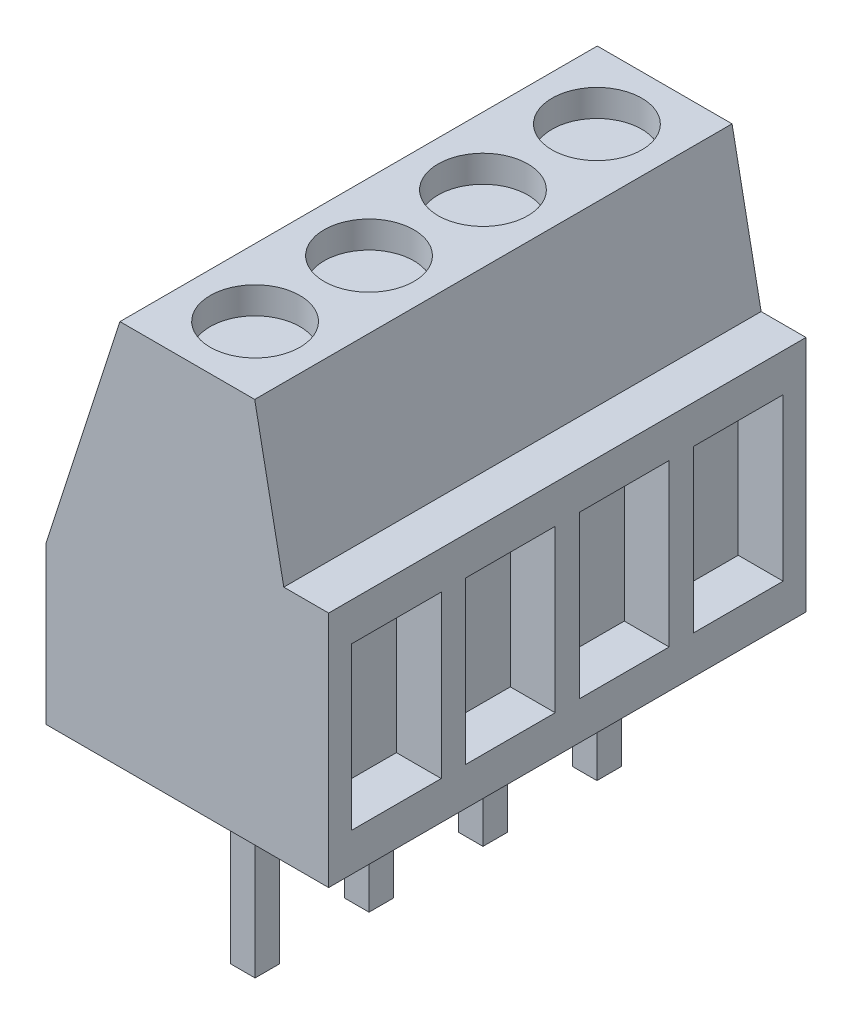
from build123d import *

# Parameters (mm, degrees)
BOSS_EXTRUDE1_DEPTH   = 10.64
SKETCH3_R             = 1
CUT_EXTRUDE1_DEPTH    = 0.6
SKETCH4_W             = 2
SKETCH4_H             = 3.6
CUT_EXTRUDE2_DEPTH    = 1
SKETCH5_W             = 0.55
SKETCH5_H             = 0.55
BOSS_EXTRUDE2_DEPTH   = 3.8
LPATTERN1_START       = 2.875
LPATTERN1_OUTLINE_W   = 3.8
LPATTERN1_OUTLINE_H   = 0.55
LPATTERN1_DEPTH       = 0.55
LPATTERN1_2_OUTLINE_W = 3.8
LPATTERN1_2_OUTLINE_H = 0.55
LPATTERN1_2_DEPTH     = 0.55
LPATTERN1_3_OUTLINE_W = 3.8
LPATTERN1_3_OUTLINE_H = 0.55
LPATTERN1_3_DEPTH     = 0.55
LPATTERN1_START_2     = 0.85
LPATTERN1_4_OUTLINE_W = 1
LPATTERN1_4_OUTLINE_H = 2
LPATTERN1_4_DEPTH     = 3.6
LPATTERN1_START_3     = 8
LPATTERN1_5_OUTLINE_R = 1
LPATTERN1_5_DEPTH     = 0.6


# Read off the part's stored shape, not the designer's step: LPattern1
with BuildPart() as part:
    # Sketch2 → Boss-Extrude1 (new body)
    with BuildSketch(Plane.XY):
        Polygon((6.3, 5.3), (5.3, 5.3), (4.652088092, 8.6), (1.647911908, 8.6), (0, 3.5), (0, 0), (6.3, 0), align=None)
    extrude(amount=-BOSS_EXTRUDE1_DEPTH)

    # Sketch3 → Cut-Extrude1 (cut)
    with BuildSketch(Plane(origin=(0, 8.6, 0), x_dir=(1, 0, 0), z_dir=(0, 1, 0))):
        with Locations(Location((3.15, 1.51, 0), (0, 0, 270))):
            Circle(SKETCH3_R)
    extrude(amount=-CUT_EXTRUDE1_DEPTH, mode=Mode.SUBTRACT)

    # Sketch4 → Cut-Extrude2 (cut)
    with BuildSketch(Plane(origin=(6.3, 0, 0), x_dir=(0, 0, -1), z_dir=(1, 0, 0))):
        with Locations((1.51, 2.65)):
            Rectangle(SKETCH4_W, SKETCH4_H)
    extrude(amount=-CUT_EXTRUDE2_DEPTH, mode=Mode.SUBTRACT)

    # LPattern1 4 outline → LPattern1 4 (cut)
    with BuildSketch(Plane(origin=(0, 0, 0), x_dir=(1, 0, 0), z_dir=(0, 1, 0)).offset(LPATTERN1_START_2)):
        with Locations((5.8, 9.13)):
            Rectangle(LPATTERN1_4_OUTLINE_W, LPATTERN1_4_OUTLINE_H)
        with Locations((5.8, 4.05)):
            Rectangle(LPATTERN1_4_OUTLINE_W, LPATTERN1_4_OUTLINE_H)
        with Locations((5.8, 6.59)):
            Rectangle(LPATTERN1_4_OUTLINE_W, LPATTERN1_4_OUTLINE_H)
    extrude(amount=LPATTERN1_4_DEPTH, mode=Mode.SUBTRACT)

    # LPattern1 5 outline → LPattern1 5 (cut)
    with BuildSketch(Plane(origin=(0, 0, 0), x_dir=(1, 0, 0), z_dir=(0, 1, 0)).offset(LPATTERN1_START_3)):
        with Locations((3.15, 9.13)):
            Circle(LPATTERN1_5_OUTLINE_R)
        with Locations((3.15, 6.59)):
            Circle(LPATTERN1_5_OUTLINE_R)
        with Locations((3.15, 4.05)):
            Circle(LPATTERN1_5_OUTLINE_R)
    extrude(amount=LPATTERN1_5_DEPTH, mode=Mode.SUBTRACT)


with BuildPart() as body_2:
    # Sketch5 → Boss-Extrude2 (new body)
    with BuildSketch(Plane.XZ):
        with Locations((3.15, -1.51)):
            Rectangle(SKETCH5_W, SKETCH5_H)
    extrude(amount=BOSS_EXTRUDE2_DEPTH)


with BuildPart() as body_3:
    # LPattern1 outline → LPattern1 (new body)
    with BuildSketch(Plane.YZ.offset(LPATTERN1_START)):
        with Locations((-1.9, -9.13)):
            Rectangle(LPATTERN1_OUTLINE_W, LPATTERN1_OUTLINE_H)
    extrude(amount=LPATTERN1_DEPTH)


with BuildPart() as body_4:
    # LPattern1 2 outline → LPattern1 2 (new body)
    with BuildSketch(Plane.YZ.offset(LPATTERN1_START)):
        with Locations((-1.9, -6.59)):
            Rectangle(LPATTERN1_2_OUTLINE_W, LPATTERN1_2_OUTLINE_H)
    extrude(amount=LPATTERN1_2_DEPTH)


with BuildPart() as body_5:
    # LPattern1 3 outline → LPattern1 3 (new body)
    with BuildSketch(Plane.YZ.offset(LPATTERN1_START)):
        with Locations((-1.9, -4.05)):
            Rectangle(LPATTERN1_3_OUTLINE_W, LPATTERN1_3_OUTLINE_H)
    extrude(amount=LPATTERN1_3_DEPTH)


solid = Compound([part.part, body_2.part, body_3.part, body_4.part, body_5.part])
